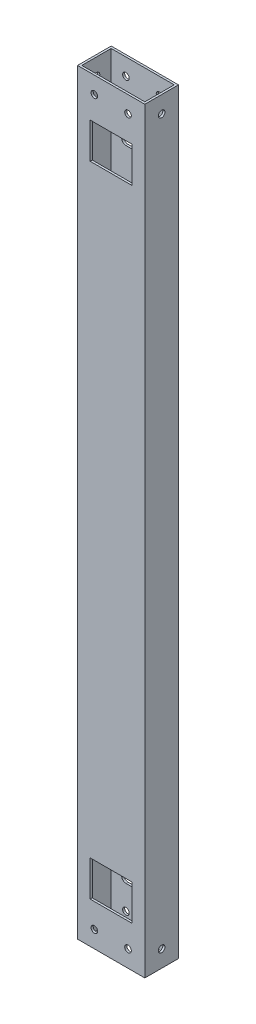
from build123d import *

# Parameters (mm, degrees)
SKETCH1_W               = 50.8
SKETCH1_H               = 571.5
BOSS_EXTRUDE1_DEPTH     = 12.7
SHELL1_T                = -1.5875
CUT_EXTRUDE1_DEPTH      = 288.157643987
CUT_EXTRUDE1_DEPTH_BACK = 288.157643987
SKETCH2_R               = 2.4892
CUT_EXTRUDE2_DEPTH      = 288.157643987
CUT_EXTRUDE2_DEPTH_BACK = 288.157643987
SKETCH3_R               = 2.4892
SKETCH4_W               = 31.75
SKETCH4_H               = 26.9875
CUT_EXTRUDE3_DEPTH      = 288.157643987
FILLET1_R               = 3.175
FILLET1_OF_MIRROR1_R    = 3.175


with BuildPart() as part:
    # Sketch1 → Boss-Extrude1 (new, symmetric)
    with BuildSketch(Plane.XY):
        Rectangle(SKETCH1_W, SKETCH1_H)
    extrude(amount=BOSS_EXTRUDE1_DEPTH, both=True)

    # Shell1
    shell1_openings = [part.faces().sort_by_distance(p)[0] for p in [
        (0, -285.75, 0),
        (0, 285.75, 0),
    ]]
    offset(amount=SHELL1_T, openings=shell1_openings, kind=Kind.INTERSECTION)

    # Sketch2 → Cut-Extrude1 (cut, two sides: drawn at the far end of the back side and taken through both)
    with BuildSketch(Plane.XY.offset(-CUT_EXTRUDE1_DEPTH_BACK)):
        with Locations((-12.7, -273.05)):
            Circle(SKETCH2_R)
        with Locations((12.7, -273.05)):
            Circle(SKETCH2_R)
        with Locations((12.7, 273.05)):
            Circle(SKETCH2_R)
        with Locations((-12.7, 273.05)):
            Circle(SKETCH2_R)
    extrude(amount=CUT_EXTRUDE1_DEPTH + CUT_EXTRUDE1_DEPTH_BACK, mode=Mode.SUBTRACT)

    # Sketch3 → Cut-Extrude2 (cut, two sides: drawn at the far end of the back side and taken through both)
    with BuildSketch(Plane(origin=(0, 0, 0), x_dir=(0, 0, -1), z_dir=(1, 0, 0)).offset(-CUT_EXTRUDE2_DEPTH_BACK)):
        with Locations((0, -273.05)):
            Circle(SKETCH3_R)
        with Locations((0, 273.05)):
            Circle(SKETCH3_R)
    extrude(amount=CUT_EXTRUDE2_DEPTH + CUT_EXTRUDE2_DEPTH_BACK, mode=Mode.SUBTRACT)

    # Sketch4 → Cut-Extrude3 (cut, symmetric)
    with BuildSketch(Plane.XY):
        with Locations((0, 241.3)):
            Rectangle(SKETCH4_W, SKETCH4_H)
    cut_extrude3 = extrude(amount=CUT_EXTRUDE3_DEPTH, both=True, mode=Mode.SUBTRACT)

    # Fillet1
    fillet1_edges = [part.edges().sort_by_distance(p)[0] for p in [
        (-15.875, 254.79375, -11.90625),
        (15.875, 227.80625, -11.90625),
        (-15.875, 227.80625, -11.90625),
        (15.875, 254.79375, -11.90625),
    ]]
    fillet(fillet1_edges, radius=FILLET1_R)

    # Mirror1: Cut-Extrude3 across plane
    add(cut_extrude3.mirror(Plane.ZX), mode=Mode.SUBTRACT)

    # Fillet1 of Mirror1
    fillet1_of_mirror1_edges = [part.edges().sort_by_distance(p)[0] for p in [
        (-15.875, -254.79375, -11.90625),
        (15.875, -227.80625, -11.90625),
        (-15.875, -227.80625, -11.90625),
        (15.875, -254.79375, -11.90625),
    ]]
    fillet(fillet1_of_mirror1_edges, radius=FILLET1_OF_MIRROR1_R)


solid = part.part
